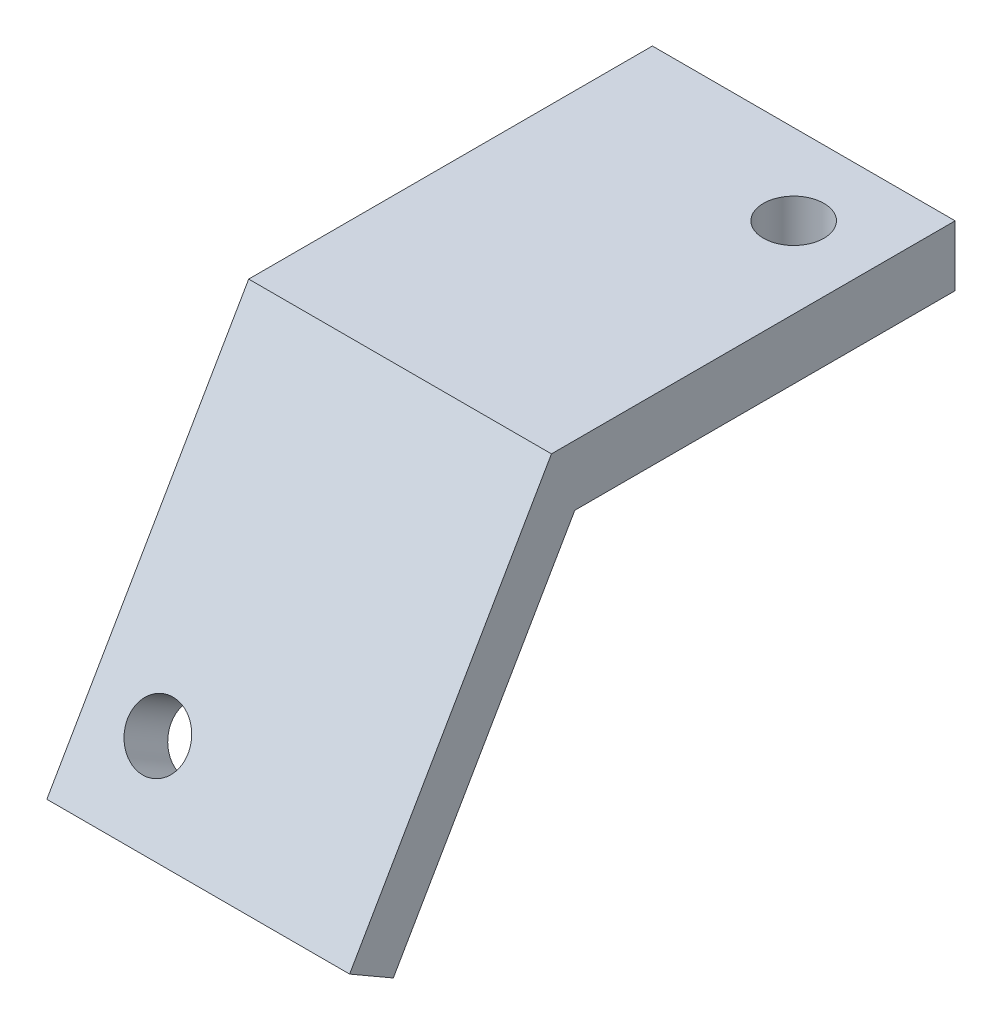
from build123d import *

# Parameters (mm, degrees)
SKETCH1_W           = 15
SKETCH1_H           = 20
SKETCH1_R           = 1.5
BOSS_EXTRUDE1_DEPTH = 3
SKETCH2_W           = 15
SKETCH2_H           = 2.5
BOSS_EXTRUDE2_DEPTH = 20
SKETCH3_R           = 1.5
CUT_EXTRUDE1_DEPTH  = 10


with BuildPart() as part:
    # Sketch1 → Boss-Extrude1 (new body)
    with BuildSketch(Plane(origin=(0, 0, 0), x_dir=(1, 0, 0), z_dir=(0, 1, 0))):
        Rectangle(SKETCH1_W, SKETCH1_H)
        with Locations((3.5, 6)):
            Circle(SKETCH1_R, mode=Mode.SUBTRACT)
    extrude(amount=BOSS_EXTRUDE1_DEPTH)

    # Sketch2 → Boss-Extrude2 (add)
    with BuildSketch(Plane(origin=(0, -2.080127019, 1.200961894), x_dir=(1, 0, 0), z_dir=(0, 0.8660254037844364, -0.5000000000000041))):
        with Locations((0, -8.910254038)):
            Rectangle(SKETCH2_W, SKETCH2_H)
    extrude(amount=-BOSS_EXTRUDE2_DEPTH)

    # Sketch3 → Cut-Extrude1 (cut)
    with BuildSketch(Plane(origin=(0, 5.080127019, 8.799038106), x_dir=(1, 0, 0), z_dir=(0, 0.500000000000004, 0.8660254037844364))):
        with Locations((-4, -18.401923789)):
            Circle(SKETCH3_R)
    extrude(amount=-CUT_EXTRUDE1_DEPTH, mode=Mode.SUBTRACT)


solid = part.part
